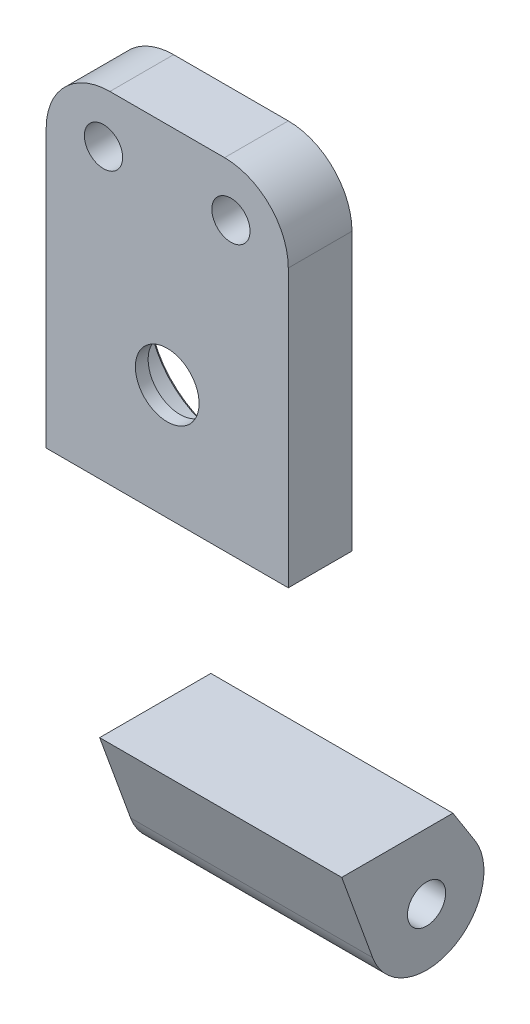
from build123d import *

# Parameters (mm, degrees)
BOSS_EXTRUDE1_START       = -0.8
BOSS_EXTRUDE1_OUTLINE_R   = 6
BOSS_EXTRUDE1_OUTLINE_R_2 = 2.5
BOSS_EXTRUDE1_DEPTH       = 1
BOSS_EXTRUDE1_START_2     = -9.5
BOSS_EXTRUDE1_2_OUTLINE_R = 2.75
BOSS_EXTRUDE1_2_DEPTH     = 19
BOSS_EXTRUDE1_START_3     = 20.214309477
BOSS_EXTRUDE1_3_OUTLINE_R = 1.25
BOSS_EXTRUDE1_3_DEPTH     = 5
SKETCH2_R                 = 6.25
CUT_EXTRUDE1_DEPTH        = 36.290497761
SKETCH3_R                 = 1.5
CUT_EXTRUDE2_DEPTH        = 10
SKETCH4_R                 = 2.75
SKETCH4_R_2               = 1.5
BOSS_EXTRUDE2_DEPTH       = 19
SKETCH5_W                 = 19.788266816
SKETCH5_H                 = 21.776938083
CUT_EXTRUDE3_DEPTH        = 45.112349032


with BuildPart() as part:
    # Boss-Extrude1: read off the stored shape, not the designer's step
    # Boss-Extrude1 outline → Boss-Extrude1 (new body)
    with BuildSketch(Plane(origin=(0, 0, 24.414309477), x_dir=(-1, 0, 0), z_dir=(0, 0, -1)).offset(BOSS_EXTRUDE1_START)):
        with Locations((0, 13.101553709)):
            Circle(BOSS_EXTRUDE1_OUTLINE_R)
        with Locations((0, 13.101553709)):
            Circle(BOSS_EXTRUDE1_OUTLINE_R_2, mode=Mode.SUBTRACT)
    extrude(amount=BOSS_EXTRUDE1_DEPTH)

    # Boss-Extrude1 2 outline → Boss-Extrude1 2 (add)
    with BuildSketch(Plane.YZ.offset(BOSS_EXTRUDE1_START_2)):
        with BuildLine():
            Line((30.808082296, 25.214309477), (-4.594884555, 25.214309477))
            ThreePointArc((-4.594884555, 25.214309477), (-6.157718154, 25.077579254), (-7.673065845, 24.671543064))
            Line((-7.673065845, 24.671543064), (-24.384342131, 18.58913592))
            ThreePointArc((-24.384342131, 18.58913592), (-26.882991431, 12.373899853), (-20.43432651, 10.560855883))
            Line((-20.43432651, 10.560855883), (-7.673065845, 18.658005573))
            ThreePointArc((-7.673065845, 18.658005573), (-5.104992299, 19.817354852), (-2.315454789, 20.214309477))
            Line((-2.315454789, 20.214309477), (30.808082296, 20.214309477))
            Line((30.808082296, 20.214309477), (30.808082296, 25.214309477))
        make_face()
        with Locations((-22.845251486, 14.360519126)):
            Circle(BOSS_EXTRUDE1_2_OUTLINE_R, mode=Mode.SUBTRACT)
    extrude(amount=BOSS_EXTRUDE1_2_DEPTH)

    # Boss-Extrude1 3 outline → Boss-Extrude1 3 (cut)
    with BuildSketch(Plane.XY.offset(BOSS_EXTRUDE1_START_3)):
        with BuildLine():
            ThreePointArc((-9.5, 25.808082296), (-8.035533906, 29.343616202), (-4.5, 30.808082296))
            Line((-4.5, 30.808082296), (-9.5, 30.808082296))
            Line((-9.5, 30.808082296), (-9.5, 25.808082296))
        make_face()
        with BuildLine():
            Line((9.5, 30.808082296), (4.5, 30.808082296))
            ThreePointArc((4.5, 30.808082296), (8.035533906, 29.343616202), (9.5, 25.808082296))
            Line((9.5, 25.808082296), (9.5, 30.808082296))
        make_face()
        with Locations((5, 26.808082296)):
            Circle(BOSS_EXTRUDE1_3_OUTLINE_R)
        with Locations((-5, 26.808082296)):
            Circle(BOSS_EXTRUDE1_3_OUTLINE_R)
    extrude(amount=BOSS_EXTRUDE1_3_DEPTH, mode=Mode.SUBTRACT)

    # Boss-Extrude1 4 outline → Boss-Extrude1 4 (revolve, cut)
    with BuildSketch(Plane.XZ.offset(-13.101553709)):
        Polygon((6, 20.714309477), (6, 24.214309477), (2.5, 24.214309477), (2.5, 25.214309477), (0, 25.214309477), (0, 20.214309477), (6.5, 20.214309477), align=None)
    revolve(axis=Axis((0, 13.101553709, 0), (0, 0, 1)), mode=Mode.SUBTRACT)

    # Sketch2 → Cut-Extrude1 (cut, through all)
    with BuildSketch(Plane(origin=(0, 0, 24.214309477), x_dir=(-1, 0, 0), z_dir=(0, 0, -1))):
        with Locations((0, 13.101553709)):
            Circle(SKETCH2_R)
    extrude(amount=CUT_EXTRUDE1_DEPTH, mode=Mode.SUBTRACT)

    # Sketch3 → Cut-Extrude2 (cut)
    with BuildSketch(Plane.XY.offset(25.214309477)):
        with Locations((-5, 26.808082296)):
            Circle(SKETCH3_R)
        with Locations((5, 26.808082296)):
            Circle(SKETCH3_R)
    extrude(amount=-CUT_EXTRUDE2_DEPTH, mode=Mode.SUBTRACT)

    # Sketch4 → Boss-Extrude2 (add)
    with BuildSketch(Plane.ZY.offset(9.5)):
        with Locations((14.360519126, -22.845251486)):
            Circle(SKETCH4_R)
        with Locations((14.360519126, -22.845251486)):
            Circle(SKETCH4_R_2, mode=Mode.SUBTRACT)
    extrude(amount=-BOSS_EXTRUDE2_DEPTH)

    # Sketch5 → Cut-Extrude3 (cut, through all)
    with BuildSketch(Plane(origin=(9.5, 0, 0), x_dir=(0, 0, -1), z_dir=(1, 0, 0))):
        with Locations((-19.035879135, -6.819131606)):
            Rectangle(SKETCH5_W, SKETCH5_H)
    extrude(amount=-CUT_EXTRUDE3_DEPTH, mode=Mode.SUBTRACT)


with BuildPart() as cut_extrude3_piece_1:
    # of the separate pieces the step leaves, piece 1, a body of its own (cut_extrude3_pieces)
    add(part.part.solids().sort_by_distance((-9.5, 25.808082296, 25.214309477))[0])


with BuildPart() as cut_extrude3_piece_2:
    # of the separate pieces the step leaves, piece 2, a body of its own (cut_extrude3_pieces)
    add(part.part.solids().sort_by_distance((-9.5, -20.43432651, 10.560855883))[0])


solid = Compound([cut_extrude3_piece_1.part, cut_extrude3_piece_2.part])
